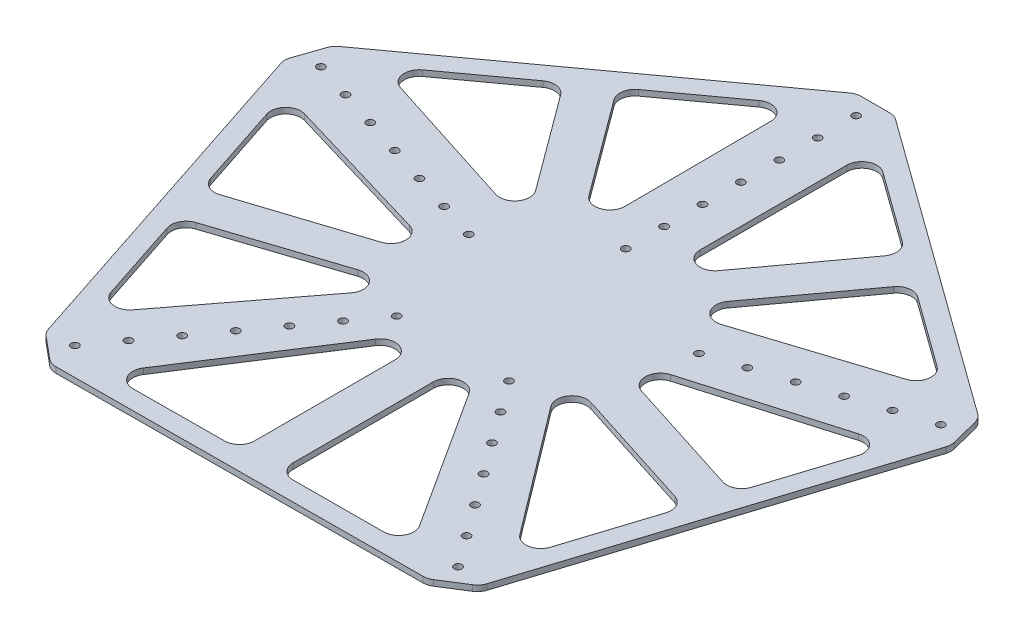
from build123d import *

# Parameters (mm, degrees)
BOSS_EXTRUDE1_DEPTH = 3.81
SKETCH1_R           = 2.54
CUT_EXTRUDE2_DEPTH  = 3.81
CUT_EXTRUDE4_DEPTH  = 25.4
FILLET1_R           = 10
CUT_EXTRUDE5_DEPTH  = 25.4
FILLET2_R           = 10
FILLET3_R           = 10


with BuildPart() as part:
    # Sketch2 → Boss-Extrude1 (new body)
    with BuildSketch(Plane(origin=(0, 0, 0), x_dir=(1, 0, 0), z_dir=(0, 1, 0))):
        Polygon((-214.113347974, 82.923214231), (-222.375187677, 58.900508182), (-144.642224503, -177.47641221), (-125.09137467, -193.780037034), (124.093192846, -192.406157618), (145.640406327, -178.850291626), (221.336035454, 58.562867157), (215.102095915, 83.244477912), (12.7, 229.477457482), (-12.7, 229.477457482), align=None)
    extrude(amount=BOSS_EXTRUDE1_DEPTH)

    # Sketch1 → Cut-Extrude2 (cut)
    with BuildSketch(Plane(origin=(0, 0, 0), x_dir=(1, 0, 0), z_dir=(0, 1, 0))):
        with Locations((0, 63.524373819)):
            Circle(SKETCH1_R)
        with Locations((0, 89.046242914)):
            Circle(SKETCH1_R)
        with Locations((0, 114.568112009)):
            Circle(SKETCH1_R)
        with Locations((0, 140.089981103)):
            Circle(SKETCH1_R)
        with Locations((0, 165.611850198)):
            Circle(SKETCH1_R)
        with Locations((0, 191.133719293)):
            Circle(SKETCH1_R)
        with Locations((0, 216.655588388)):
            Circle(SKETCH1_R)
        with Locations((84.688009575, 27.516802346)):
            Circle(SKETCH1_R)
        with Locations((108.960749485, 35.403493624)):
            Circle(SKETCH1_R)
        with Locations((133.233489396, 43.290184903)):
            Circle(SKETCH1_R)
        with Locations((157.506229307, 51.176876181)):
            Circle(SKETCH1_R)
        with Locations((181.778969217, 59.06356746)):
            Circle(SKETCH1_R)
        with Locations((206.051709128, 66.950258738)):
            Circle(SKETCH1_R)
        with Locations((37.338690092, -51.392297977)):
            Circle(SKETCH1_R)
        with Locations((52.340068357, -72.039923802)):
            Circle(SKETCH1_R)
        with Locations((67.341446622, -92.687549628)):
            Circle(SKETCH1_R)
        with Locations((82.342824886, -113.335175454)):
            Circle(SKETCH1_R)
        with Locations((97.344203151, -133.98280128)):
            Circle(SKETCH1_R)
        with Locations((112.345581416, -154.630427106)):
            Circle(SKETCH1_R)
        with Locations((127.346959681, -175.278052932)):
            Circle(SKETCH1_R)
        with Locations((-37.338690092, -51.392297977)):
            Circle(SKETCH1_R)
        with Locations((-52.340068357, -72.039923802)):
            Circle(SKETCH1_R)
        with Locations((-67.341446622, -92.687549628)):
            Circle(SKETCH1_R)
        with Locations((-82.342824886, -113.335175454)):
            Circle(SKETCH1_R)
        with Locations((-97.344203151, -133.98280128)):
            Circle(SKETCH1_R)
        with Locations((-112.345581416, -154.630427106)):
            Circle(SKETCH1_R)
        with Locations((-127.346959681, -175.278052932)):
            Circle(SKETCH1_R)
        with Locations((-60.415269664, 19.630111067)):
            Circle(SKETCH1_R)
        with Locations((-84.688009575, 27.516802346)):
            Circle(SKETCH1_R)
        with Locations((-108.960749485, 35.403493624)):
            Circle(SKETCH1_R)
        with Locations((-133.233489396, 43.290184903)):
            Circle(SKETCH1_R)
        with Locations((-157.506229307, 51.176876181)):
            Circle(SKETCH1_R)
        with Locations((-181.778969217, 59.06356746)):
            Circle(SKETCH1_R)
        with Locations((-206.051709128, 66.950258738)):
            Circle(SKETCH1_R)
    extrude(amount=CUT_EXTRUDE2_DEPTH, mode=Mode.SUBTRACT)

    # Sketch4 → Cut-Extrude4 (cut)
    with BuildSketch(Plane(origin=(0, 3.81, 0), x_dir=(1, 0, 0), z_dir=(0, 1, 0))):
        Polygon((-45.070854373, 42.218517188), (-116.134569677, 138.509259641), (-186.385554028, 87.392588613), align=None)
    extrude(amount=-CUT_EXTRUDE4_DEPTH, mode=Mode.SUBTRACT)

    # Fillet1
    fillet1_edges = [part.edges().sort_by_distance(p)[0] for p in [
        (-186.385554028, 1.905, -87.392588613),
        (-45.070854373, 1.905, -42.218517188),
        (-116.134569677, 1.905, -138.509259641),
    ]]
    fillet(fillet1_edges, radius=FILLET1_R)

    # Sketch4<3> → Cut-Extrude5 (cut)
    with BuildSketch(Plane(origin=(0, 3.81, 0), x_dir=(1, 0, 0), z_dir=(0, 1, 0))):
        Polygon((-45.070854373, 42.218517188), (-116.134569677, 138.509259641), (-186.385554028, 87.392588613), align=None)
        Polygon((-25.263196152, 204.629928972), (-95.595688183, 153.453950571), (-24.449522239, 57.051488188), align=None)
        Polygon((96.100640401, 153.553690969), (25.4, 204.634018259), (25.4, 57.052227702), align=None)
        Polygon((46.069621628, 42.286739176), (116.689753838, 138.678314353), (187.309886047, 87.656153224), align=None)
        Polygon((-54.313264472, -4.068117885), (-202.740299234, 39.846930078), (-175.394631138, -43.308073239), align=None)
        Polygon((-46.329229165, -27.545327403), (-167.47690719, -67.384952942), (-140.115544314, -150.587682263), align=None)
        Polygon((-12.7, -43.090401677), (-101.684923108, -180.937649266), (-12.7, -180.397220358), align=None)
        Polygon((12.7, -43.122873263), (12.7, -180.257313283), (100.864034479, -179.820968664), align=None)
        Polygon((46.904199543, -26.956649015), (140.994368681, -151.614087132), (168.389811964, -65.690516628), align=None)
        Polygon((56.068689502, -3.218822472), (201.972389344, 39.638494676), (176.105537606, -41.490773287), align=None)
    extrude(amount=-CUT_EXTRUDE5_DEPTH, mode=Mode.SUBTRACT)

    # Fillet2
    fillet2_edges = [part.edges().sort_by_distance(p)[0] for p in [
        (96.100640401, 1.905, -153.553690969),
        (25.4, 1.905, -204.634018259),
        (25.4, 1.905, -57.052227702),
        (116.689753838, 1.905, -138.678314353),
        (46.069621628, 1.905, -42.286739176),
        (187.309886047, 1.905, -87.656153224),
        (56.068689502, 1.905, 3.218822472),
        (176.105537606, 1.905, 41.490773287),
        (201.972389344, 1.905, -39.638494676),
        (46.904199543, 1.905, 26.956649015),
        (140.994368681, 1.905, 151.614087132),
        (168.389811964, 1.905, 65.690516628),
        (12.7, 1.905, 180.257313283),
        (100.864034479, 1.905, 179.820968664),
        (12.7, 1.905, 43.122873263),
        (-12.7, 1.905, 43.090401677),
        (-101.684923108, 1.905, 180.937649266),
        (-12.7, 1.905, 180.397220358),
        (-54.313264472, 1.905, 4.068117885),
        (-175.394631138, 1.905, 43.308073239),
        (-202.740299234, 1.905, -39.846930078),
        (-167.47690719, 1.905, 67.384952942),
        (-140.115544314, 1.905, 150.587682263),
        (-46.329229165, 1.905, 27.545327403),
        (-24.449522239, 1.905, -57.051488188),
        (-25.263196152, 1.905, -204.629928972),
        (-95.595688183, 1.905, -153.453950571),
        (-45.070854373, 1.905, -42.218517188),
        (-116.134569677, 1.905, -138.509259641),
        (-186.385554028, 1.905, -87.392588613),
    ]]
    fillet(fillet2_edges, radius=FILLET2_R)

    # Fillet3
    fillet3_edges = [part.edges().sort_by_distance(p)[0] for p in [
        (-12.7, 1.905, -229.477457482),
        (12.7, 1.905, -229.477457482),
        (215.102095915, 1.905, -83.244477912),
        (221.336035454, 1.905, -58.562867157),
        (145.640406327, 1.905, 178.850291626),
        (124.093192846, 1.905, 192.406157618),
        (-125.09137467, 1.905, 193.780037034),
        (-144.642224503, 1.905, 177.47641221),
        (-222.375187677, 1.905, -58.900508182),
        (-214.113347974, 1.905, -82.923214231),
    ]]
    fillet(fillet3_edges, radius=FILLET3_R)


solid = part.part
